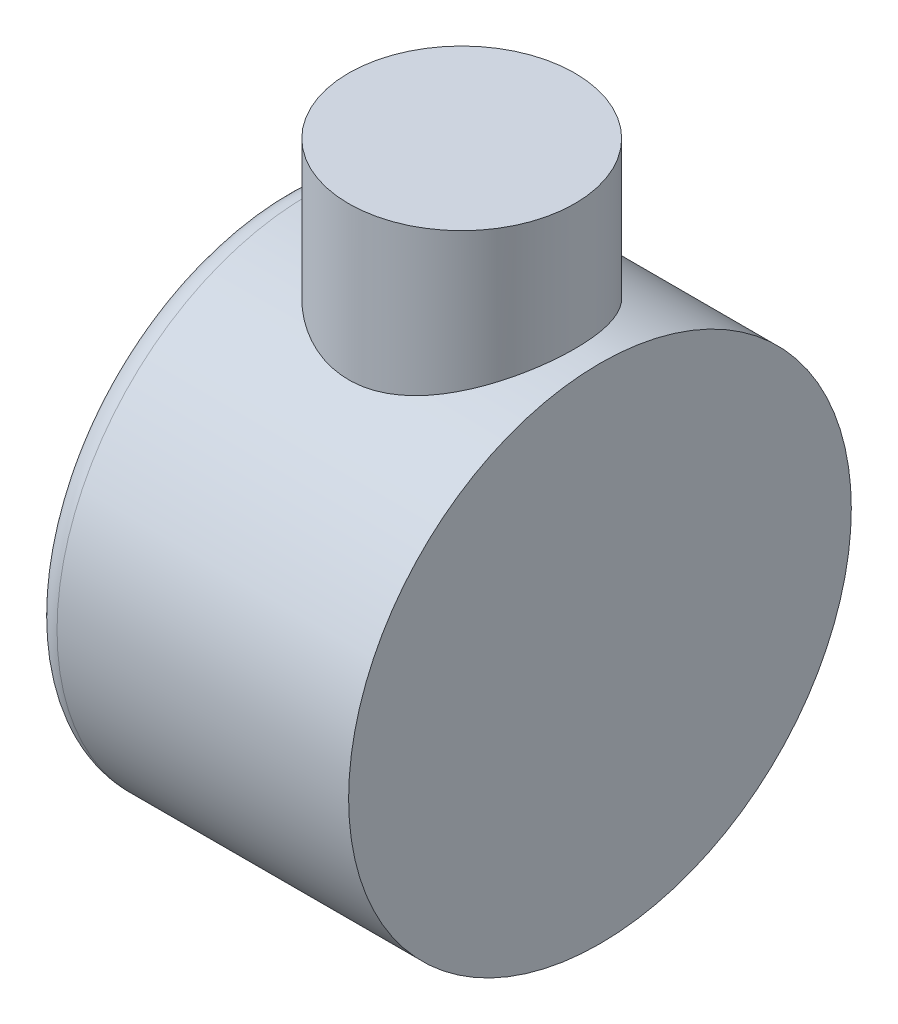
from build123d import *

# Parameters (mm, degrees)
SKETCH2_R           = 50
BOSS_EXTRUDE1_DEPTH = 55
BOSS_EXTRUDE2_START = 8
SKETCH4_R           = 50
BOSS_EXTRUDE2_DEPTH = 8
FILLET1_R           = 5


with BuildPart() as part:
    # Sketch2 → Boss-Extrude1 (new body)
    with BuildSketch(Plane(origin=(0, 0, 0), x_dir=(0, 0, -1), z_dir=(1, 0, 0))):
        Circle(SKETCH2_R)
    extrude(amount=BOSS_EXTRUDE1_DEPTH)


with BuildPart() as revolve1_tool:
    # Sketch3 → Revolve1 (revolve)
    with BuildSketch(Plane.ZY.offset(-27.5)):
        with BuildLine():
            Line((0, 75), (0, 50))
            ThreePointArc((0, 50), (11.563490229, 48.644482665), (22.5, 44.651427749))
            Line((22.5, 44.651427749), (22.5, 75))
            Line((22.5, 75), (0, 75))
        make_face()
    revolve(axis=Axis((27.5, 50, 0), (0, 1, 0)))


with BuildPart() as part_1:
    add(part.part)


with BuildPart() as part_2:
    # Revolve1: joined with revolve1_tool
    add(part_1.part.fuse(revolve1_tool.part, tol=0.00001))

    # Sketch4 → Boss-Extrude2 (add)
    with BuildSketch(Plane.ZY.offset(BOSS_EXTRUDE2_START)):
        Circle(SKETCH4_R)
    extrude(amount=-BOSS_EXTRUDE2_DEPTH)

    # Fillet1
    fillet1_edges = [part_2.edges().sort_by_distance(p)[0] for p in [
        (-8, 0, -50),
    ]]
    fillet(fillet1_edges, radius=FILLET1_R)


solid = part_2.part
